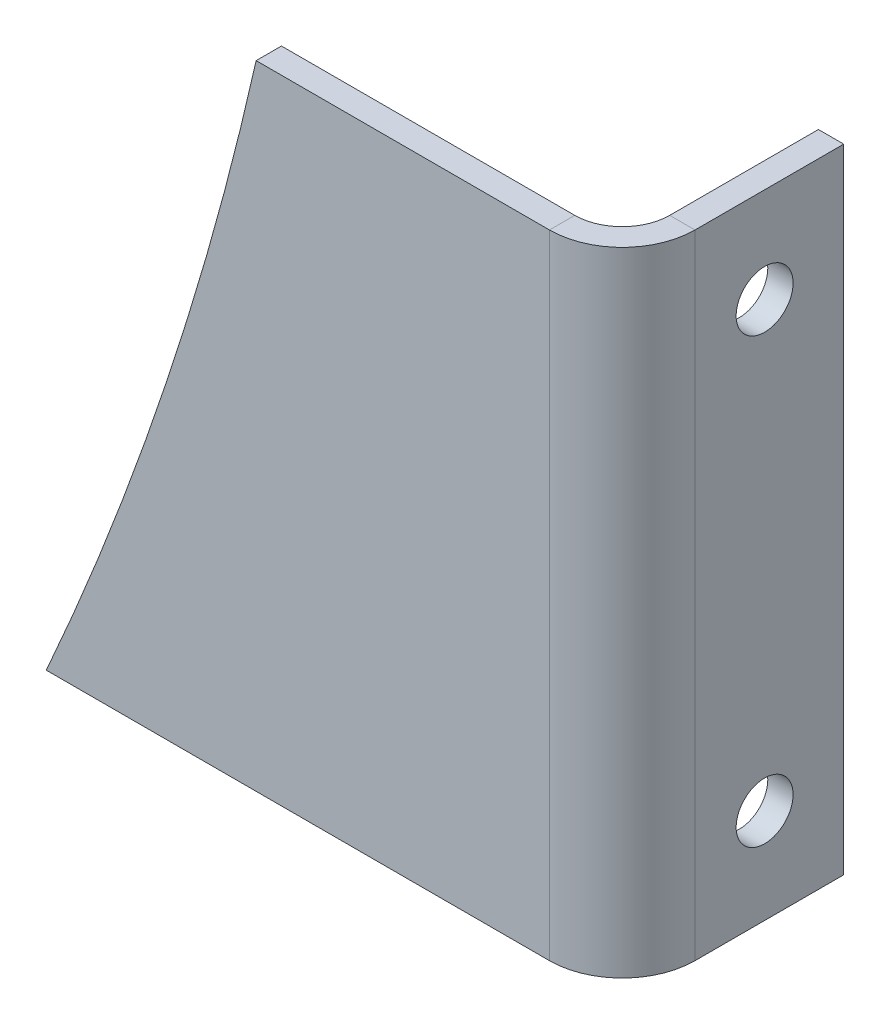
from build123d import *

# Parameters (mm, degrees)
SKETCH1_W                    = 70
SKETCH1_H                    = 200
BASE_FLANGE1_DEPTH           = 8
EDGE_FLANGE1_STRIP_W         = 62
EDGE_FLANGE1_STRIP_H         = 8
EDGE_FLANGE1_STRIP_CUT_DEPTH = 200
EDGE_FLANGE1_DEPTH           = 200
SKETCH9_R                    = 1060
CUT_EXTRUDE1_DEPTH           = 10
SKETCH10_R                   = 9
CUT_EXTRUDE2_DEPTH           = 10


# Sheet-metal steps are written as plain solids
with BuildPart() as part:
    # Sketch1 → Base-Flange1 (new body)
    with BuildSketch(Plane(origin=(0, 0, 0), x_dir=(0, 0, -1), z_dir=(1, 0, 0))):
        Rectangle(SKETCH1_W, SKETCH1_H)
    extrude(amount=-BASE_FLANGE1_DEPTH)

    # Edge-Flange1 strip (across the edge) → Edge-Flange1 strip cut (cut)
    with BuildSketch(Plane(origin=(-8, -100, 35), x_dir=(0, 0, -1), z_dir=(0, 1, 0))):
        with Locations((-8, -4)):
            Rectangle(EDGE_FLANGE1_STRIP_W, EDGE_FLANGE1_STRIP_H)
    extrude(amount=EDGE_FLANGE1_STRIP_CUT_DEPTH, mode=Mode.SUBTRACT)

    # Edge-Flange1 section (across the edge) → Edge-Flange1 (add)
    with BuildSketch(Plane(origin=(-8, -100, 35), x_dir=(0, 0, -1), z_dir=(0, 1, 0))):
        with BuildLine():
            Line((0, 15), (0, 242))
            Line((0, 242), (8, 242))
            Line((8, 242), (8, 15))
            ThreePointArc((8, 15), (12.393398282, 4.393398282), (23, 0))
            Line((23, 0), (23, -8))
            ThreePointArc((23, -8), (6.736544033, -1.263455967), (0, 15))
        make_face()
    extrude(amount=EDGE_FLANGE1_DEPTH)

    # Sketch9 → Cut-Extrude1 (cut)
    with BuildSketch(Plane.XY.offset(35)):
        with Locations((-1150, 332)):
            Circle(SKETCH9_R)
    extrude(amount=-CUT_EXTRUDE1_DEPTH, mode=Mode.SUBTRACT)

    # Sketch10 → Cut-Extrude2 (cut)
    with BuildSketch(Plane(origin=(0, 0, 0), x_dir=(0, 0, -1), z_dir=(1, 0, 0))):
        with Locations((10, -70)):
            Circle(SKETCH10_R)
        with Locations((10, 70)):
            Circle(SKETCH10_R)
    extrude(amount=-CUT_EXTRUDE2_DEPTH, mode=Mode.SUBTRACT)


solid = part.part
